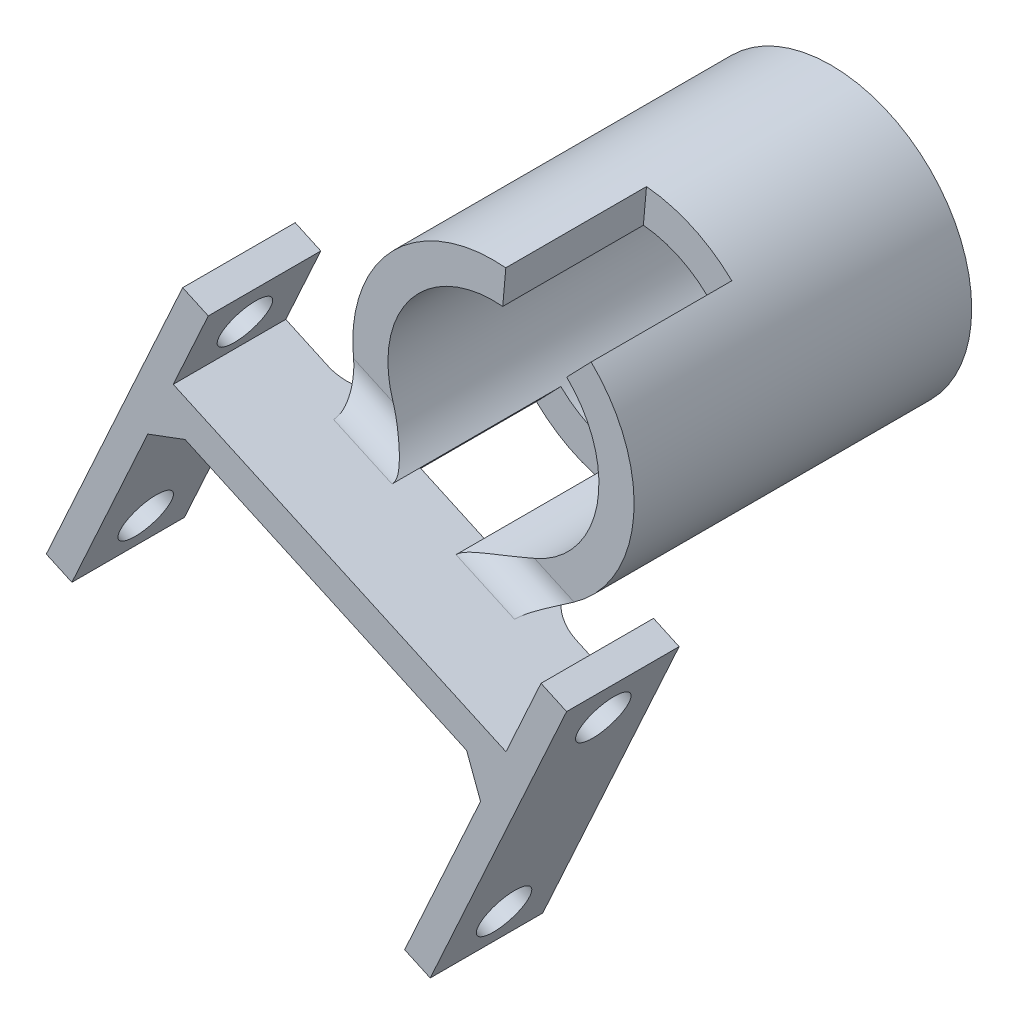
from build123d import *
from build123d.topology import SkipClean

# Parameters (mm, degrees)
SKETCH1_R           = 7.5
SKETCH1_R_2         = 3.285
BOSS_EXTRUDE1_DEPTH = 2
SKETCH1_3_R         = 10
SKETCH1_3_R_2       = 7.5
BOSS_EXTRUDE2_DEPTH = 14
BOSS_EXTRUDE3_DEPTH = 10
BOSS_EXTRUDE4_DEPTH = 8
FILLET1_R           = 2
FILLET2_R           = 2
SKETCH4_W           = 2
SKETCH4_H           = 8
BOSS_EXTRUDE5_DEPTH = 15
CHAMFER1_SIZE       = 2
CUT_EXTRUDE1_REACH  = 55.102
SKETCH6_R           = 1.825
SKETCH7_W           = 2
SKETCH7_H           = 8
BOSS_EXTRUDE6_DEPTH = 6
CUT_EXTRUDE2_REACH  = 56.289
SKETCH8_R           = 1.825


with BuildPart() as part:
    # Sketch1 → Boss-Extrude1 (new body)
    with BuildSketch(Plane.XY):
        Circle(SKETCH1_R)
        Circle(SKETCH1_R_2, mode=Mode.SUBTRACT)
    extrude(amount=BOSS_EXTRUDE1_DEPTH)

    # Sketch1<3> → Boss-Extrude2 (add)
    with BuildSketch(Plane.XY):
        Circle(SKETCH1_3_R)
        Circle(SKETCH1_3_R_2, mode=Mode.SUBTRACT)
    extrude(amount=BOSS_EXTRUDE2_DEPTH)

    # Sketch2 → Boss-Extrude3 (add)
    with SkipClean():  # the faces are left unmerged after this step: merging them gives an invalid solid
        with BuildSketch(Plane.XY.offset(14)):
            with BuildLine():
                ThreePointArc((0.880723614, 9.961140794), (-9.097879067, 4.150734451), (-6.945976325, -7.193984493))
                Line((-6.945976325, -7.193984493), (-5.209482244, -5.39548837))
                ThreePointArc((-5.209482244, -5.39548837), (-6.8234093, 3.113050838), (0.66054271, 7.470855595))
                Line((0.66054271, 7.470855595), (0.880723614, 9.961140794))
            make_face()
            with BuildLine():
                Line((-0.66054271, -7.470855595), (-0.880723614, -9.961140794))
                ThreePointArc((-0.880723614, -9.961140794), (6.752509306, -7.375880833), (10, 0))
                ThreePointArc((10, 0), (9.204883575, 3.907699883), (6.945976325, 7.193984493))
                Line((6.945976325, 7.193984493), (5.209482244, 5.39548837))
                ThreePointArc((5.209482244, 5.39548837), (6.903662681, 2.930774912), (7.5, 0))
                ThreePointArc((7.5, 0), (5.06438198, -5.531910625), (-0.66054271, -7.470855595))
            make_face()
        extrude(amount=BOSS_EXTRUDE3_DEPTH)

    # Sketch3 → Boss-Extrude4 (add)
    with SkipClean():  # the faces are left unmerged after this step: merging them gives an invalid solid
        with BuildSketch(Plane.XY.offset(24)):
            Polygon((10.711806124, -12.659273659), (9.733468631, -14.80366432), (-17.56016857, -2.351460968), (-16.581831078, -0.207070307), align=None)
        extrude(amount=BOSS_EXTRUDE4_DEPTH)

    # Fillet1
    # the kernel refuses this fillet: 2 mm, written as the material it adds along each edge
    with BuildSketch(Plane(origin=(-5.209482244, -5.39548837, 24), x_dir=(0.4150734450654639, 0.9097879067131457, 0), z_dir=(0.9097879067131457, -0.41507344506546395, 0))) as fillet1_piece_1_section:
        with BuildLine():
            CenterArc((FILLET1_R, FILLET1_R), FILLET1_R, 180, 90)
            Line((0, FILLET1_R), (0, 0))
            Line((0, 0), (FILLET1_R, 0))
        make_face()
    fillet1_piece_1 = extrude(amount=14.571067812, mode=Mode.PRIVATE)
    fillet1_piece_1 = fillet1_piece_1 & Plane(origin=(0, 0, 24.466684855), x_dir=(-0.08807236135728662, -0.9961140793929938, 0), z_dir=(0, 0, -1)) * Cylinder(10, 38, mode=Mode.PRIVATE)
    fillet1_piece_1 = fillet1_piece_1 - Plane(origin=(0, 0, 24.466684855), x_dir=(0.6945976324993828, 0.7193984493493522, 0), z_dir=(0, 0, -1)) * Cylinder(7.5, 38, mode=Mode.PRIVATE)
    add(fillet1_piece_1)
    with BuildSketch(Plane(origin=(-13.917123993, -1.42279228, 24), x_dir=(0.4150734450654639, 0.9097879067131457, 0), z_dir=(0.9097879067131457, -0.41507344506546395, 0))) as fillet1_piece_2_section:
        with BuildLine():
            CenterArc((FILLET1_R, FILLET1_R), FILLET1_R, 180, 90)
            Line((0, FILLET1_R), (0, 0))
            Line((0, 0), (FILLET1_R, 0))
        make_face()
    fillet1_piece_2 = extrude(amount=14.571067812, mode=Mode.PRIVATE)
    fillet1_piece_2 = fillet1_piece_2 & Plane(origin=(0, 0, 24.466680249), x_dir=(0.08807236135728662, 0.9961140793929938, 0), z_dir=(0, 0, -1)) * Cylinder(10, 38, mode=Mode.PRIVATE)
    fillet1_piece_2 = fillet1_piece_2 - Plane(origin=(0, 0, 24.466680249), x_dir=(0.6945976324993828, 0.7193984493493522, 0), z_dir=(0, 0, -1)) * Cylinder(7.5, 38, mode=Mode.PRIVATE)
    add(fillet1_piece_2)

    # Fillet2
    # the kernel refuses this fillet: 2 mm, written as the material it adds along each edge
    with BuildSketch(Plane(origin=(0, 0, 24), x_dir=(-0.9898439357335846, 0.14215830222483344, 0), z_dir=(0.14215830222483344, 0.9898439357335846, 0))) as fillet2_piece_1_section:
        with BuildLine():
            CenterArc((10 + FILLET2_R, -FILLET2_R), FILLET2_R, 90, 90)
            Line((10 + FILLET2_R, 0), (10, 0))
            Line((10, 0), (10, -FILLET2_R))
        make_face()
    fillet2_piece_1 = revolve(axis=Axis((0, 0, 24), (0, 0, 1)), revolution_arc=82.826410261, mode=Mode.PRIVATE)
    fillet2_piece_1 = split(fillet2_piece_1, bisect_by=Plane(origin=(-8.477218422, -3.904645831, 23.537511225), z_dir=(-0.41507344506546395, -0.9097879067131457, 0)), keep=Keep.TOP, mode=Mode.PRIVATE)
    fillet2_piece_1 = split(fillet2_piece_1, bisect_by=Plane(origin=(-9.455555915, -6.049036492, 23.537511225), z_dir=(0.41507344506546395, 0.9097879067131456, 0)), keep=Keep.TOP, mode=Mode.PRIVATE)
    add(fillet2_piece_1)
    with BuildSketch(Plane(origin=(0, 0, 24), x_dir=(0.7561376391606037, -0.6544126149797455, 0), z_dir=(0.6544126149797455, 0.7561376391606037, 0))) as fillet2_piece_2_section:
        with BuildLine():
            CenterArc((10 + FILLET2_R, FILLET2_R), FILLET2_R, 180, 90)
            Line((10 + FILLET2_R, 0), (10, 0))
            Line((10, 0), (10, FILLET2_R))
        make_face()
    fillet2_piece_2 = revolve(axis=Axis((0, 0, 24), (0, 0, -1)), revolution_arc=82.826410261, mode=Mode.PRIVATE)
    fillet2_piece_2 = split(fillet2_piece_2, bisect_by=Plane(origin=(2.607194883, -8.96169878, 23.537511389), z_dir=(-0.41507344506546395, -0.9097879067131457, 0)), keep=Keep.TOP, mode=Mode.PRIVATE)
    fillet2_piece_2 = split(fillet2_piece_2, bisect_by=Plane(origin=(1.628857391, -11.106089441, 23.537511389), z_dir=(0.41507344506546395, 0.9097879067131456, 0)), keep=Keep.TOP, mode=Mode.PRIVATE)
    add(fillet2_piece_2)

    # Sketch4 → Boss-Extrude5 (add)
    with BuildSketch(Plane(origin=(-3.913349969, -8.577562644, 0), x_dir=(0.9097879067131455, -0.4150734450654641, 0), z_dir=(-0.4150734450654641, -0.9097879067131455, 0))):
        with Locations((-14, 28)):
            Rectangle(SKETCH4_W, SKETCH4_H)
        with Locations((14, 28)):
            Rectangle(SKETCH4_W, SKETCH4_H)
    extrude(amount=BOSS_EXTRUDE5_DEPTH)

    # Chamfer1
    chamfer1_edges = [part.edges().sort_by_distance(p)[0] for p in [
        (-15.740592757, -3.181607858, 28),
        (7.913892818, -13.97351743, 28),
    ]]
    chamfer(chamfer1_edges, length=CHAMFER1_SIZE)

    # Cut-Extrude1: up to this face of the body (flat: up to its plane)
    cut_extrude1_end = Plane(part.part.faces().sort_by_distance((7.10958654, -20.55487829, 28))[0])
    # Sketch6 → Cut-Extrude1 (cut, up to the picked face)
    with BuildSketch(Plane(origin=(-13.646818601, 6.226101676, 0), x_dir=(0, 0, 1), z_dir=(-0.9097879067131456, 0.41507344506546384, 0)), mode=Mode.PRIVATE) as cut_extrude1_sk1:
        with Locations(Location((28, -21.428090416, 0), (0, 0, 270))):
            Circle(SKETCH6_R)
    cut_extrude1_tool1 = split(extrude(cut_extrude1_sk1.sketch, amount=-CUT_EXTRUDE1_REACH, mode=Mode.PRIVATE), bisect_by=cut_extrude1_end, keep=Keep.BOTH, mode=Mode.PRIVATE)
    add(cut_extrude1_tool1.solids().sort_by(Axis((-22.54105, -13.268916, 28), (0.9097879067131456, -0.41507344506546384, 0)))[0], mode=Mode.SUBTRACT)

    # Sketch7 → Boss-Extrude6 (add)
    with BuildSketch(Plane(origin=(-2.935012477, -6.433171983, 0), x_dir=(0.9097879067131457, -0.4150734450654639, 0), z_dir=(0.41507344506546384, 0.9097879067131456, 0))):
        with Locations((14, -28)):
            Rectangle(SKETCH7_W, SKETCH7_H)
        with Locations((-14, -28)):
            Rectangle(SKETCH7_W, SKETCH7_H)
    extrude(amount=BOSS_EXTRUDE6_DEPTH)

    # Cut-Extrude2: up to this face of the body (flat: up to its plane)
    cut_extrude2_end = Plane(part.part.faces().sort_by_distance((7.301672081, -20.133851349, 28))[0])
    # Sketch8 → Cut-Extrude2 (cut, up to the picked face)
    with BuildSketch(Plane(origin=(-13.646818601, 6.226101676, 0), x_dir=(0, 0, 1), z_dir=(-0.9097879067131456, 0.4150734450654639, 0)), mode=Mode.PRIVATE) as cut_extrude2_sk1:
        with Locations(Location((28, -4.428090416, 0), (0, 0, 270))):
            Circle(SKETCH8_R)
    cut_extrude2_tool1 = split(extrude(cut_extrude2_sk1.sketch, amount=-CUT_EXTRUDE2_REACH, mode=Mode.PRIVATE), bisect_by=cut_extrude2_end, keep=Keep.BOTH, mode=Mode.PRIVATE)
    add(cut_extrude2_tool1.solids().sort_by(Axis((-15.484801, 2.197479, 28), (0.9097879067131456, -0.4150734450654639, 0)))[0], mode=Mode.SUBTRACT)


solid = part.part
